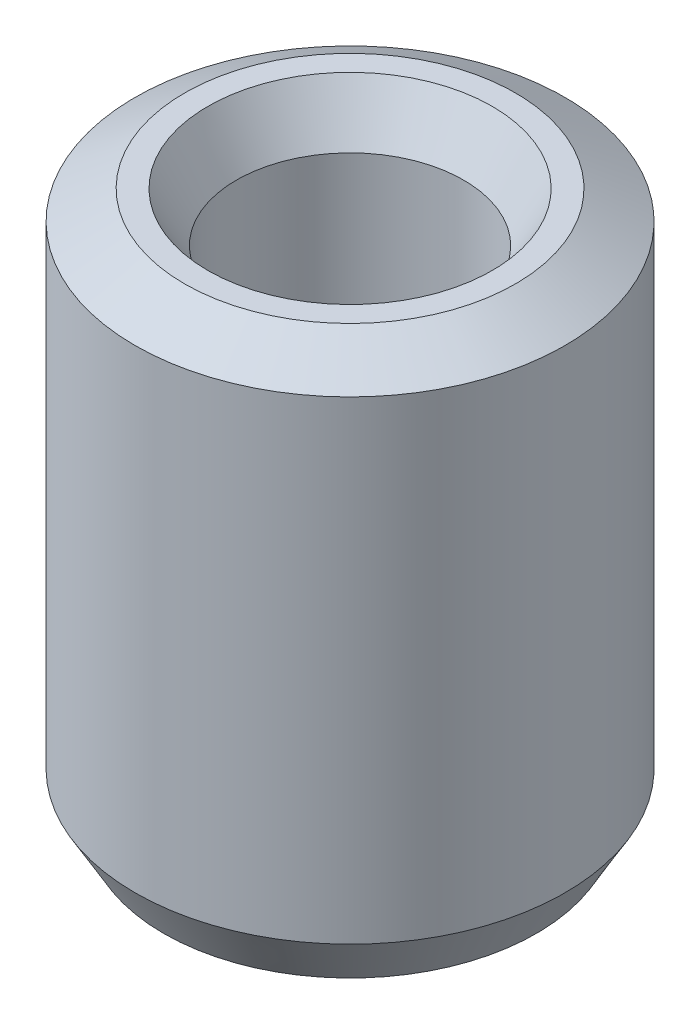
from build123d import *
from OCP.BRepFilletAPI import BRepFilletAPI_MakeChamfer

# Parameters (mm, degrees)
SKETCH1_R           = 10
BOSS_EXTRUDE1_DEPTH = 25.6827487
SKETCH2_R           = 5.284975512
CUT_EXTRUDE1_DEPTH  = 30.318996927
CHAMFER1_SIZE       = 1.330305583
CHAMFER1_SIZE2      = 2.304156859


with BuildPart() as part:
    # Sketch1 → Boss-Extrude1 (new body)
    with BuildSketch(Plane(origin=(0, 0, 0), x_dir=(1, 0, 0), z_dir=(0, 1, 0))):
        Circle(SKETCH1_R)
    extrude(amount=BOSS_EXTRUDE1_DEPTH)

    # Sketch2 → Cut-Extrude1 (cut, through all)
    with BuildSketch(Plane(origin=(0, 0, 0), x_dir=(1, 0, 0), z_dir=(0, 1, 0))):
        Circle(SKETCH2_R)
    extrude(amount=CUT_EXTRUDE1_DEPTH, mode=Mode.SUBTRACT)

    # Chamfer1: one chamfer whose edges measure the first distance from different faces: ONE call of the kernel's chamfer builder (chamfer() names one face for all edges)
    chamfer1_edges_1 = [part.edges().sort_by_distance(p)[0] for p in [
        (-5.284975512, 25.6827487, 0),
    ]]
    chamfer1_side_1 = [part.faces().sort_by_distance(p)[0] for p in [
        (-9.717157288, 25.6827487, 0),
    ]]
    chamfer1_edges_2 = [part.edges().sort_by_distance(p)[0] for p in [
        (-5.284975512, 0, 0),
    ]]
    chamfer1_side_2 = [part.faces().sort_by_distance(p)[0] for p in [
        (-5.284975512, 12.84137435, 0),
    ]]
    chamfer1_edges_3 = [part.edges().sort_by_distance(p)[0] for p in [
        (-10, 0, 0),
    ]]
    chamfer1_side_3 = [part.faces().sort_by_distance(p)[0] for p in [
        (-9.717157288, 0, 0),
    ]]
    chamfer1_edges_4 = [part.edges().sort_by_distance(p)[0] for p in [
        (-10, 25.6827487, 0),
    ]]
    chamfer1_side_4 = [part.faces().sort_by_distance(p)[0] for p in [
        (-10, 12.84137435, 0),
    ]]
    chamfer1 = BRepFilletAPI_MakeChamfer(part.part.solid().wrapped)
    for e in chamfer1_edges_1:
        chamfer1.Add(CHAMFER1_SIZE, CHAMFER1_SIZE2, e.wrapped, chamfer1_side_1[0].wrapped)  # the first distance lies on this face
    for e in chamfer1_edges_2:
        chamfer1.Add(CHAMFER1_SIZE, CHAMFER1_SIZE2, e.wrapped, chamfer1_side_2[0].wrapped)  # the first distance lies on this face
    for e in chamfer1_edges_3:
        chamfer1.Add(CHAMFER1_SIZE, CHAMFER1_SIZE2, e.wrapped, chamfer1_side_3[0].wrapped)  # the first distance lies on this face
    for e in chamfer1_edges_4:
        chamfer1.Add(CHAMFER1_SIZE, CHAMFER1_SIZE2, e.wrapped, chamfer1_side_4[0].wrapped)  # the first distance lies on this face
    add(Compound.cast(chamfer1.Shape()), mode=Mode.REPLACE)


solid = part.part
